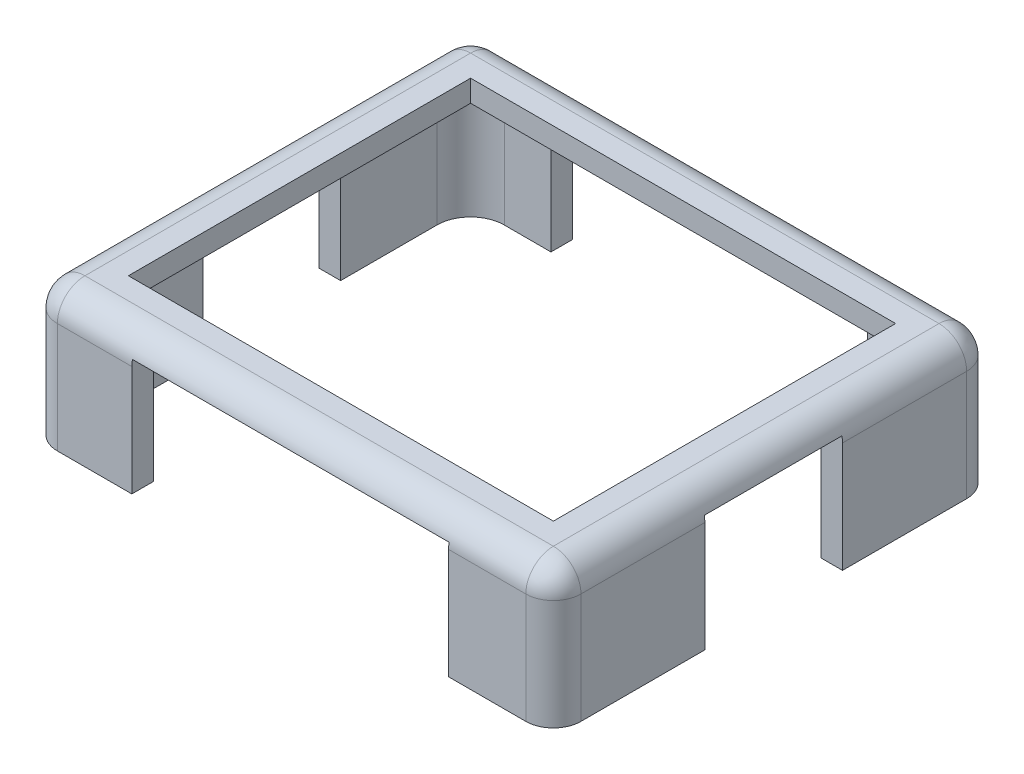
from build123d import *

# Parameters (mm, degrees)
SKETCH1_W           = 48.2092
SKETCH1_H           = 40.5892
BOSS_EXTRUDE1_DEPTH = 12.7
SHELL1_T            = -2
CUT_EXTRUDE2_DEPTH  = 68.58
FILLET6_R           = 2.54
FILLET7_R           = 2.54
FILLET8_R           = 2.54
FILLET9_R           = 2.54
FILLET10_R          = 2.54
SKETCH6_W           = 39.1292
SKETCH6_H           = 31.5092
CUT_EXTRUDE4_DEPTH  = 68.58
CUT_EXTRUDE5_DEPTH  = 49.276
FILLET19_R          = 3.0988


with BuildPart() as part:
    # Sketch1 → Boss-Extrude1 (new body)
    with BuildSketch(Plane(origin=(0, 0, 0), x_dir=(1, 0, 0), z_dir=(0, 1, 0))):
        Rectangle(SKETCH1_W, SKETCH1_H)
    extrude(amount=BOSS_EXTRUDE1_DEPTH)

    # Shell1
    shell1_openings = [part.faces().sort_by_distance(p)[0] for p in [
        (0, 0, 0),
    ]]
    offset(amount=SHELL1_T, openings=shell1_openings, kind=Kind.INTERSECTION)

    # Sketch4 → Cut-Extrude2 (cut)
    with BuildSketch(Plane.ZY.offset(24.1046)):
        Polygon((0, 0), (6.35, 0), (6.35, 10.69848), (-6.3246, 10.69848), (-6.3246, 0), align=None)
    extrude(amount=-CUT_EXTRUDE2_DEPTH, mode=Mode.SUBTRACT)

    # Fillet6
    # the kernel refuses this fillet: 2.54 mm, written as the material it takes off along each edge
    with BuildSketch(Plane(origin=(30.4546, 12.7, -20.2946), x_dir=(0, -1, 0), z_dir=(-1, 0, 0))) as fillet6_piece_1:
        with BuildLine():
            CenterArc((FILLET6_R, FILLET6_R), FILLET6_R, 180, 90)
            Line((0, FILLET6_R), (0, 0))
            Line((0, 0), (FILLET6_R, 0))
        make_face()
    extrude(amount=60.9092, mode=Mode.SUBTRACT)
    with BuildSketch(Plane(origin=(24.1046, 12.7, 26.6446), x_dir=(0, -1, 0), z_dir=(0, 0, -1)), Plane(origin=(-24.1046, 12.7, -26.6446), x_dir=(0, -1, 0), z_dir=(0, 0, 1))) as fillet6_piece_2:
        with BuildLine():
            CenterArc((FILLET6_R, FILLET6_R), FILLET6_R, 180, 90)
            Line((0, FILLET6_R), (0, 0))
            Line((0, 0), (FILLET6_R, 0))
        make_face()
    extrude(amount=53.2892, mode=Mode.SUBTRACT)
    with BuildSketch(Plane(origin=(-30.4546, 12.7, 20.2946), x_dir=(0, 0, -1), z_dir=(1, 0, 0))) as fillet6_piece_3:
        with BuildLine():
            CenterArc((FILLET6_R, -FILLET6_R), FILLET6_R, 90, 90)
            Line((0, -FILLET6_R), (0, 0))
            Line((0, 0), (FILLET6_R, 0))
        make_face()
    extrude(amount=60.9092, mode=Mode.SUBTRACT)

    # Fillet7
    # the kernel refuses this fillet: 2.54 mm, written as the material it takes off along each edge
    with BuildSketch(Plane(origin=(-21.5646, 10.16, -17.7546), x_dir=(-1, 0, 0), z_dir=(0, 0, -1))) as fillet7_piece_1_section:
        Polygon((0, 0), (FILLET7_R, 0), (FILLET7_R, FILLET7_R), (0, FILLET7_R), align=None)
    fillet7_piece_1 = extrude(amount=FILLET7_R, mode=Mode.PRIVATE)
    fillet7_piece_1 = fillet7_piece_1 - Plane(origin=(-21.5646, 10.16, -17.7546), x_dir=(0.7071067811865475, -0.7071067811865475, 0), z_dir=(0, 0, -1)) * Sphere(FILLET7_R, mode=Mode.PRIVATE)
    add(fillet7_piece_1, mode=Mode.SUBTRACT)
    with BuildSketch(Plane(origin=(-24.1046, -6.35, -20.2946), x_dir=(1, 0, 0), z_dir=(0, 1, 0))) as fillet7_piece_2:
        with BuildLine():
            CenterArc((FILLET7_R, -FILLET7_R), FILLET7_R, 90, 90)
            Line((0, -FILLET7_R), (0, 0))
            Line((0, 0), (FILLET7_R, 0))
        make_face()
    extrude(amount=16.51, mode=Mode.SUBTRACT)

    # Fillet8
    # the kernel refuses this fillet: 2.54 mm, written as the material it takes off along each edge
    with BuildSketch(Plane(origin=(-21.5646, 10.16, 17.7546), x_dir=(-1, 0, 0), z_dir=(0, 0, 1))) as fillet8_piece_1_section:
        Polygon((0, 0), (FILLET8_R, 0), (FILLET8_R, -FILLET8_R), (0, -FILLET8_R), align=None)
    fillet8_piece_1 = extrude(amount=FILLET8_R, mode=Mode.PRIVATE)
    fillet8_piece_1 = fillet8_piece_1 - Plane(origin=(-21.5646, 10.16, 17.7546), x_dir=(0.7071067811865475, -0.7071067811865475, 0), z_dir=(0, 0, 1)) * Sphere(FILLET8_R, mode=Mode.PRIVATE)
    add(fillet8_piece_1, mode=Mode.SUBTRACT)
    with BuildSketch(Plane(origin=(-24.1046, -6.35, 20.2946), x_dir=(1, 0, 0), z_dir=(0, 1, 0))) as fillet8_piece_2:
        with BuildLine():
            CenterArc((FILLET8_R, FILLET8_R), FILLET8_R, 180, 90)
            Line((0, FILLET8_R), (0, 0))
            Line((0, 0), (FILLET8_R, 0))
        make_face()
    extrude(amount=16.51, mode=Mode.SUBTRACT)

    # Fillet9
    # the kernel refuses this fillet: 2.54 mm, written as the material it takes off along each edge
    with BuildSketch(Plane(origin=(21.5646, 10.16, -17.7546), x_dir=(1, 0, 0), z_dir=(0, 0, -1))) as fillet9_piece_1_section:
        Polygon((0, 0), (FILLET9_R, 0), (FILLET9_R, -FILLET9_R), (0, -FILLET9_R), align=None)
    fillet9_piece_1 = extrude(amount=FILLET9_R, mode=Mode.PRIVATE)
    fillet9_piece_1 = fillet9_piece_1 - Plane(origin=(21.5646, 10.16, -17.7546), x_dir=(-0.7071067811865475, -0.7071067811865475, 0), z_dir=(0, 0, -1)) * Sphere(FILLET9_R, mode=Mode.PRIVATE)
    add(fillet9_piece_1, mode=Mode.SUBTRACT)
    with BuildSketch(Plane(origin=(24.1046, -6.35, -20.2946), x_dir=(-1, 0, 0), z_dir=(0, 1, 0))) as fillet9_piece_2:
        with BuildLine():
            CenterArc((FILLET9_R, FILLET9_R), FILLET9_R, 180, 90)
            Line((0, FILLET9_R), (0, 0))
            Line((0, 0), (FILLET9_R, 0))
        make_face()
    extrude(amount=16.51, mode=Mode.SUBTRACT)

    # Fillet10
    # the kernel refuses this fillet: 2.54 mm, written as the material it takes off along each edge
    with BuildSketch(Plane(origin=(21.5646, 10.16, 17.7546), x_dir=(1, 0, 0), z_dir=(0, 0, 1))) as fillet10_piece_1_section:
        Polygon((0, 0), (FILLET10_R, 0), (FILLET10_R, FILLET10_R), (0, FILLET10_R), align=None)
    fillet10_piece_1 = extrude(amount=FILLET10_R, mode=Mode.PRIVATE)
    fillet10_piece_1 = fillet10_piece_1 - Plane(origin=(21.5646, 10.16, 17.7546), x_dir=(-0.7071067811865475, -0.7071067811865475, 0), z_dir=(0, 0, 1)) * Sphere(FILLET10_R, mode=Mode.PRIVATE)
    add(fillet10_piece_1, mode=Mode.SUBTRACT)
    with BuildSketch(Plane(origin=(24.1046, -6.35, 20.2946), x_dir=(-1, 0, 0), z_dir=(0, 1, 0))) as fillet10_piece_2:
        with BuildLine():
            CenterArc((FILLET10_R, -FILLET10_R), FILLET10_R, 90, 90)
            Line((0, -FILLET10_R), (0, 0))
            Line((0, 0), (FILLET10_R, 0))
        make_face()
    extrude(amount=16.51, mode=Mode.SUBTRACT)

    # Sketch6 → Cut-Extrude4 (cut)
    with BuildSketch(Plane(origin=(0, 12.7, 0), x_dir=(1, 0, 0), z_dir=(0, 1, 0))):
        Rectangle(SKETCH6_W, SKETCH6_H)
    extrude(amount=-CUT_EXTRUDE4_DEPTH, mode=Mode.SUBTRACT)

    # Sketch3 → Cut-Extrude5 (cut)
    with BuildSketch(Plane.XY.offset(20.2946)):
        Polygon((14.4526, 10.69848), (-12.1666, 10.69848), (-14.7066, 10.69848), (-14.7066, 0), (14.4526, 0), align=None)
    extrude(amount=-CUT_EXTRUDE5_DEPTH, mode=Mode.SUBTRACT)

    # Fillet19
    fillet19_edges = [part.edges().sort_by_distance(p)[0] for p in [
        (-22.1046, 5.35, -18.2946),
        (-22.1046, 5.35, 18.2946),
        (22.1046, 5.35, 18.2946),
        (22.1046, 5.35, -18.2946),
    ]]
    fillet(fillet19_edges, radius=FILLET19_R)


solid = part.part
